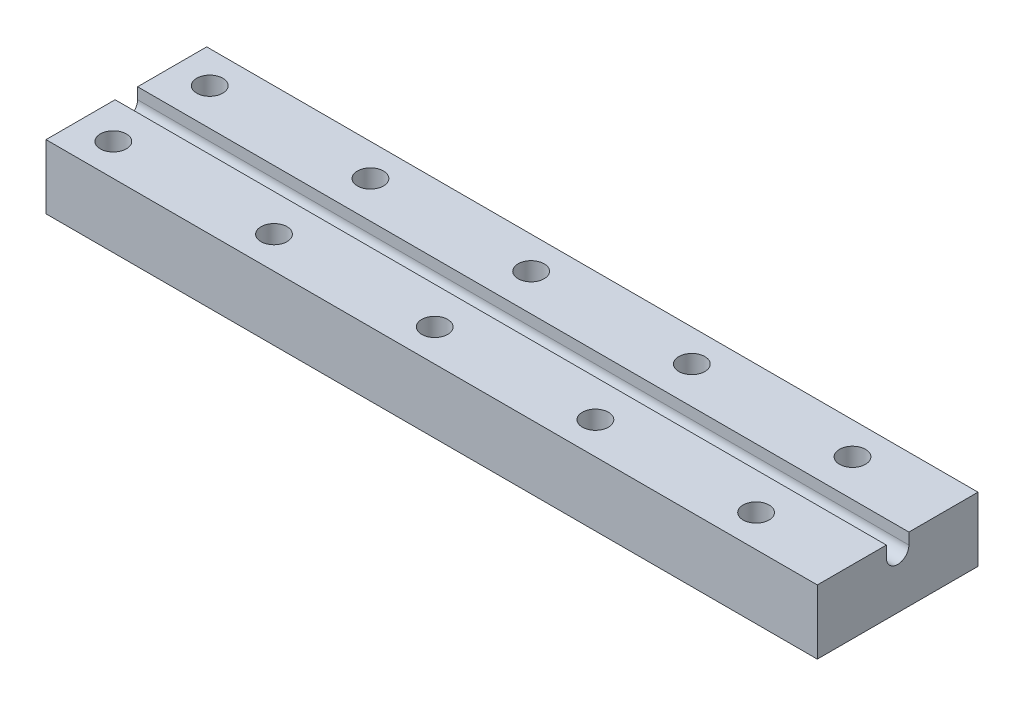
from build123d import *

# Parameters (mm, degrees)
SKETCH1_W               = 240
SKETCH1_H               = 50
BOSS_EXTRUDE1_DEPTH     = 20
CUT_EXTRUDE1_DEPTH      = 30
CUT_EXTRUDE1_DEPTH_BACK = 254
SKETCH3_R               = 4.05
CUT_EXTRUDE2_DEPTH      = 67


with BuildPart() as part:
    # Sketch1 → Boss-Extrude1 (new body)
    with BuildSketch(Plane(origin=(0, 0, 0), x_dir=(1, 0, 0), z_dir=(0, 1, 0))):
        with Locations((120, 25)):
            Rectangle(SKETCH1_W, SKETCH1_H)
    extrude(amount=BOSS_EXTRUDE1_DEPTH)

    # Sketch2 → Cut-Extrude1 (cut, two sides: drawn at the far end of the back side and taken through both)
    with BuildSketch(Plane.ZY.offset(-CUT_EXTRUDE1_DEPTH_BACK)):
        with BuildLine():
            Line((-28.5, 20), (-28.5, 16.5))
            ThreePointArc((-28.5, 16.5), (-25, 13), (-21.5, 16.5))
            Line((-21.5, 16.5), (-21.5, 20))
            Line((-21.5, 20), (-28.5, 20))
        make_face()
    extrude(amount=CUT_EXTRUDE1_DEPTH + CUT_EXTRUDE1_DEPTH_BACK, mode=Mode.SUBTRACT)

    # Sketch3 → Cut-Extrude2 (cut)
    with BuildSketch(Plane.XZ):
        with Locations((10.95, -10)):
            Circle(SKETCH3_R)
        with Locations((10.95, -40)):
            Circle(SKETCH3_R)
        with Locations((60.95, -10)):
            Circle(SKETCH3_R)
        with Locations((60.95, -40)):
            Circle(SKETCH3_R)
        with Locations((110.95, -10)):
            Circle(SKETCH3_R)
        with Locations((110.95, -40)):
            Circle(SKETCH3_R)
        with Locations((160.95, -10)):
            Circle(SKETCH3_R)
        with Locations((160.95, -40)):
            Circle(SKETCH3_R)
        with Locations((210.95, -10)):
            Circle(SKETCH3_R)
        with Locations((210.95, -40)):
            Circle(SKETCH3_R)
    extrude(amount=-CUT_EXTRUDE2_DEPTH, mode=Mode.SUBTRACT)


solid = part.part
